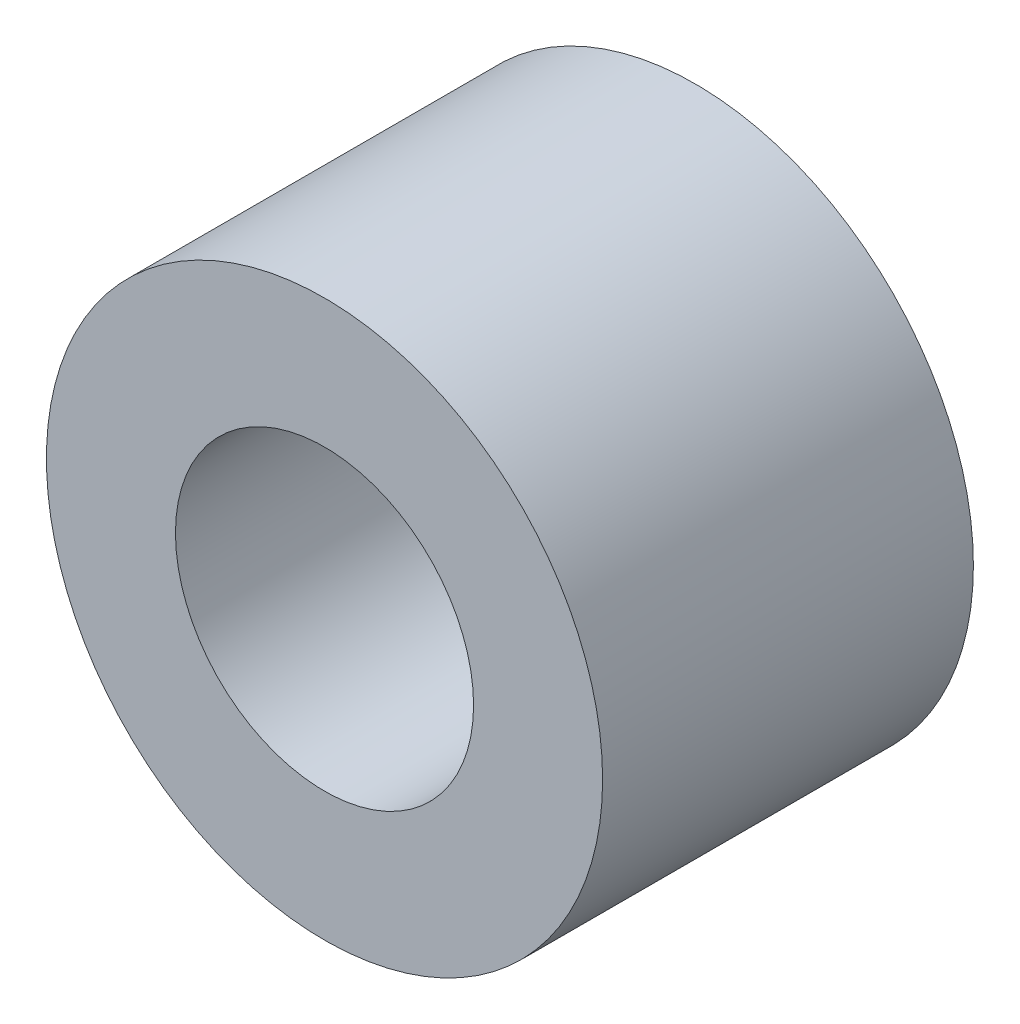
from build123d import *

# Parameters (mm, degrees)
SKETCH1_R           = 4.7625
SKETCH1_R_2         = 2.5527
BOSS_EXTRUDE1_DEPTH = 3.175


with BuildPart() as part:
    # Sketch1 → Boss-Extrude1 (new, symmetric)
    with BuildSketch(Plane.XY):
        Circle(SKETCH1_R)
        Circle(SKETCH1_R_2, mode=Mode.SUBTRACT)
    extrude(amount=BOSS_EXTRUDE1_DEPTH, both=True)


solid = part.part
